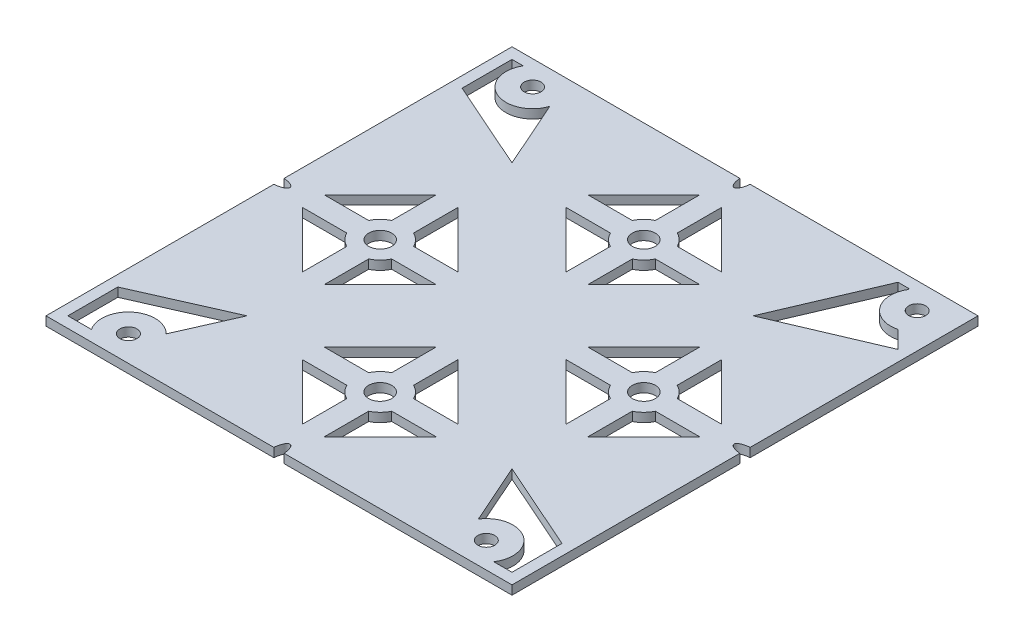
from build123d import *

# Parameters (mm, degrees)
SKETCH1_W           = 97.6
SKETCH1_H           = 97.6
BOSS_EXTRUDE1_DEPTH = 1.85
SKETCH3_R           = 1.25
CUT_EXTRUDE1_DEPTH  = 10
FILLET1_R           = 0.2
SKETCH5_R           = 2.375
CUT_EXTRUDE2_DEPTH  = 10
SKETCH6_R           = 1.75
CUT_EXTRUDE3_DEPTH  = 139.039641188
SKETCH7_W           = 97.6
SKETCH7_H           = 1.85
CUT_EXTRUDE4_DEPTH  = 0.75
SKETCH8_W           = 96.85
SKETCH8_H           = 1.85
CUT_EXTRUDE5_DEPTH  = 0.75
SKETCH9_W           = 96.85
SKETCH9_H           = 1.85
CUT_EXTRUDE6_DEPTH  = 0.75
SKETCH12_W          = 96.1
SKETCH12_H          = 1.85
CUT_EXTRUDE7_DEPTH  = 0.75


with BuildPart() as part:
    # Sketch1 → Boss-Extrude1 (new body)
    with BuildSketch(Plane(origin=(0, 0, 0), x_dir=(1, 0, 0), z_dir=(0, 1, 0))):
        with Locations((48.8, 48.8)):
            Rectangle(SKETCH1_W, SKETCH1_H)
    extrude(amount=BOSS_EXTRUDE1_DEPTH)

    # Sketch3 → Cut-Extrude1 (cut)
    with BuildSketch(Plane.XZ):
        with BuildLine():
            Line((3, -84.3), (3, -94.6))
            Line((3, -94.6), (5.316079849, -94.6))
            ThreePointArc((5.316079849, -94.6), (7.792729855, -86.784550719), (15.285000001, -90.113353923))
            Line((15.285000001, -90.113353923), (21.472818771, -76.127181229))
            Line((21.472818771, -76.127181229), (3, -84.3))
        make_face()
        with BuildLine():
            Line((3, -13.3), (21.472818771, -21.472818771))
            Line((21.472818771, -21.472818771), (16.360495139, -9.917560959))
            ThreePointArc((16.360495139, -9.917560959), (8.975209709, -10.313312378), (7.873156109, -3))
            Line((7.873156109, -3), (3, -3))
            Line((3, -3), (3, -13.3))
        make_face()
        with BuildLine():
            Line((94.6, -13.3), (94.6, -3))
            Line((94.6, -3), (90.826843891, -3))
            ThreePointArc((90.826843891, -3), (89.267333256, -10.648445392), (81.630186258, -9.034513526))
            Line((81.630186258, -9.034513526), (76.127181229, -21.472818771))
            Line((76.127181229, -21.472818771), (94.6, -13.3))
        make_face()
        with BuildLine():
            Line((91.027327292, -86.172672708), (94.6, -82.6))
            Line((94.6, -82.6), (73.674141566, -73.674141566))
            Line((73.674141566, -73.674141566), (82.6, -94.6))
            Line((82.6, -94.6), (85.116873323, -94.6))
            ThreePointArc((85.116873323, -94.6), (85.157069093, -88.341897208), (91.027327292, -86.172672708))
        make_face()
        with Locations((89.66, -91.5)):
            Circle(SKETCH3_R)
        with Locations((10.05, -91.8)):
            Circle(SKETCH3_R)
        with Locations((12.45, -6.05)):
            Circle(SKETCH3_R)
        with Locations((86.25, -6.05)):
            Circle(SKETCH3_R)
    extrude(amount=-CUT_EXTRUDE1_DEPTH, mode=Mode.SUBTRACT)

    # Fillet1
    fillet1_edges = [part.edges().sort_by_distance(p)[0] for p in [
        (85.116873323, 0.925, -94.6),
    ]]
    fillet(fillet1_edges, radius=FILLET1_R)

    # Sketch5 → Cut-Extrude2 (cut)
    with BuildSketch(Plane.XZ):
        with BuildLine():
            Line((51.05, -80.617052601), (51.05, -89.767052601))
            Line((51.05, -89.767052601), (62.582493929, -78.234558673))
            Line((62.582493929, -78.234558673), (53.432493929, -78.234558673))
            ThreePointArc((53.432493929, -78.234558673), (52.441599923, -79.626158596), (51.05, -80.617052601))
        make_face()
        with BuildLine():
            Line((46.55, -89.767052601), (46.55, -80.617052601))
            ThreePointArc((46.55, -80.617052601), (45.158400077, -79.626158596), (44.167506071, -78.234558673))
            Line((44.167506071, -78.234558673), (35.017506071, -78.234558673))
            Line((35.017506071, -78.234558673), (46.55, -89.767052601))
        make_face()
        with BuildLine():
            Line((35.017506071, -73.734558673), (44.167506071, -73.734558673))
            ThreePointArc((44.167506071, -73.734558673), (45.158400077, -72.34295875), (46.55, -71.352064744))
            Line((46.55, -71.352064744), (46.55, -62.202064744))
            Line((46.55, -62.202064744), (35.017506071, -73.734558673))
        make_face()
        with BuildLine():
            ThreePointArc((51.05, -71.352064744), (52.441599923, -72.34295875), (53.432493929, -73.734558673))
            Line((53.432493929, -73.734558673), (62.582493929, -73.734558673))
            Line((62.582493929, -73.734558673), (51.05, -62.202064744))
            Line((51.05, -62.202064744), (51.05, -71.352064744))
        make_face()
        with BuildLine():
            Line((73.734558673, -35.017506071), (62.202064744, -46.55))
            Line((62.202064744, -46.55), (71.352064744, -46.55))
            ThreePointArc((71.352064744, -46.55), (72.34295875, -45.158400077), (73.734558673, -44.167506071))
            Line((73.734558673, -44.167506071), (73.734558673, -35.017506071))
        make_face()
        with BuildLine():
            ThreePointArc((73.734558673, -53.432493929), (72.34295875, -52.441599923), (71.352064744, -51.05))
            Line((71.352064744, -51.05), (62.202064744, -51.05))
            Line((62.202064744, -51.05), (73.734558673, -62.582493929))
            Line((73.734558673, -62.582493929), (73.734558673, -53.432493929))
        make_face()
        with BuildLine():
            Line((78.234558673, -35.017506071), (78.234558673, -44.167506071))
            ThreePointArc((78.234558673, -44.167506071), (79.626158596, -45.158400077), (80.617052601, -46.55))
            Line((80.617052601, -46.55), (89.767052601, -46.55))
            Line((89.767052601, -46.55), (78.234558673, -35.017506071))
        make_face()
        with BuildLine():
            ThreePointArc((80.617052601, -51.05), (79.626158596, -52.441599923), (78.234558673, -53.432493929))
            Line((78.234558673, -53.432493929), (78.234558673, -62.582493929))
            Line((78.234558673, -62.582493929), (89.767052601, -51.05))
            Line((89.767052601, -51.05), (80.617052601, -51.05))
        make_face()
        with BuildLine():
            Line((46.55, -16.982947399), (46.55, -7.832947399))
            Line((46.55, -7.832947399), (35.017506071, -19.365441327))
            Line((35.017506071, -19.365441327), (44.167506071, -19.365441327))
            ThreePointArc((44.167506071, -19.365441327), (45.158400077, -17.973841404), (46.55, -16.982947399))
        make_face()
        with BuildLine():
            Line((51.05, -7.832947399), (51.05, -16.982947399))
            ThreePointArc((51.05, -16.982947399), (52.441599923, -17.973841404), (53.432493929, -19.365441327))
            Line((53.432493929, -19.365441327), (62.582493929, -19.365441327))
            Line((62.582493929, -19.365441327), (51.05, -7.832947399))
        make_face()
        with BuildLine():
            ThreePointArc((46.55, -26.247935256), (45.158400077, -25.25704125), (44.167506071, -23.865441327))
            Line((44.167506071, -23.865441327), (35.017506071, -23.865441327))
            Line((35.017506071, -23.865441327), (46.55, -35.397935256))
            Line((46.55, -35.397935256), (46.55, -26.247935256))
        make_face()
        with BuildLine():
            Line((62.582493929, -23.865441327), (53.432493929, -23.865441327))
            ThreePointArc((53.432493929, -23.865441327), (52.441599923, -25.25704125), (51.05, -26.247935256))
            Line((51.05, -26.247935256), (51.05, -35.397935256))
            Line((51.05, -35.397935256), (62.582493929, -23.865441327))
        make_face()
        with BuildLine():
            Line((23.865441327, -62.582493929), (35.397935256, -51.05))
            Line((35.397935256, -51.05), (26.247935256, -51.05))
            ThreePointArc((26.247935256, -51.05), (25.25704125, -52.441599923), (23.865441327, -53.432493929))
            Line((23.865441327, -53.432493929), (23.865441327, -62.582493929))
        make_face()
        with BuildLine():
            Line((19.365441327, -62.582493929), (19.365441327, -53.432493929))
            ThreePointArc((19.365441327, -53.432493929), (17.973841404, -52.441599923), (16.982947399, -51.05))
            Line((16.982947399, -51.05), (7.832947399, -51.05))
            Line((7.832947399, -51.05), (19.365441327, -62.582493929))
        make_face()
        with BuildLine():
            ThreePointArc((23.865441327, -44.167506071), (25.25704125, -45.158400077), (26.247935256, -46.55))
            Line((26.247935256, -46.55), (35.397935256, -46.55))
            Line((35.397935256, -46.55), (23.865441327, -35.017506071))
            Line((23.865441327, -35.017506071), (23.865441327, -44.167506071))
        make_face()
        with BuildLine():
            Line((7.832947399, -46.55), (16.982947399, -46.55))
            ThreePointArc((16.982947399, -46.55), (17.973841404, -45.158400077), (19.365441327, -44.167506071))
            Line((19.365441327, -44.167506071), (19.365441327, -35.017506071))
            Line((19.365441327, -35.017506071), (7.832947399, -46.55))
        make_face()
        with BuildLine():
            Line((47.7, -97.6), (49.9, -97.6))
            add(Edge.make_bspline(
                [(49.9, -97.6), (49.9, -94.604595373), (48.8, -94.604595373)],
                knots=[4.71238898, 4.71238898, 4.71238898, 6.283185307, 6.283185307, 6.283185307], degree=2, weights=[1, 0.707106781, 1]))
            add(Edge.make_bspline(
                [(48.8, -94.604595373), (47.7, -94.604595373), (47.7, -97.6)],
                knots=[0, 0, 0, 1.570796327, 1.570796327, 1.570796327], degree=2, weights=[1, 0.707106781, 1]))
        make_face()
        with BuildLine():
            add(Edge.make_bspline(
                [(94.596161078, -48.8), (94.596161078, -49.9), (97.6, -49.9)],
                knots=[0, 0, 0, 1.570796327, 1.570796327, 1.570796327], degree=2, weights=[1, 0.707106781, 1]))
            Line((97.6, -49.9), (97.6, -47.7))
            add(Edge.make_bspline(
                [(97.6, -47.7), (94.596161078, -47.7), (94.596161078, -48.8)],
                knots=[4.71238898, 4.71238898, 4.71238898, 6.283185307, 6.283185307, 6.283185307], degree=2, weights=[1, 0.707106781, 1]))
        make_face()
        with BuildLine():
            Line((0, -47.7), (0, -49.9))
            add(Edge.make_bspline(
                [(0, -49.9), (3, -49.9), (3, -48.8)],
                knots=[4.71238898, 4.71238898, 4.71238898, 6.283185307, 6.283185307, 6.283185307], degree=2, weights=[1, 0.707106781, 1]))
            add(Edge.make_bspline(
                [(3, -48.8), (3, -47.7), (0, -47.7)],
                knots=[0, 0, 0, 1.570796327, 1.570796327, 1.570796327], degree=2, weights=[1, 0.707106781, 1]))
        make_face()
        with BuildLine():
            add(Edge.make_bspline(
                [(48.8, -3), (49.9, -3), (49.9, 0)],
                knots=[0, 0, 0, 1.570796327, 1.570796327, 1.570796327], degree=2, weights=[1, 0.707106781, 1]))
            Line((49.9, 0), (47.7, 0))
            add(Edge.make_bspline(
                [(47.7, 0), (47.7, -3), (48.8, -3)],
                knots=[4.71238898, 4.71238898, 4.71238898, 6.283185307, 6.283185307, 6.283185307], degree=2, weights=[1, 0.707106781, 1]))
        make_face()
        with Locations((48.8, -75.984558673)):
            Circle(SKETCH5_R)
        with Locations((75.984558673, -48.8)):
            Circle(SKETCH5_R)
        with Locations((48.8, -21.615441327)):
            Circle(SKETCH5_R)
        with Locations((21.615441327, -48.8)):
            Circle(SKETCH5_R)
    extrude(amount=-CUT_EXTRUDE2_DEPTH, mode=Mode.SUBTRACT)

    # Sketch6 → Cut-Extrude3 (cut, through all)
    with BuildSketch(Plane.XZ):
        with Locations((12.45, -6.05)):
            Circle(SKETCH6_R)
        with Locations((86.25, -6.05)):
            Circle(SKETCH6_R)
        with Locations((10.05, -91.8)):
            Circle(SKETCH6_R)
        with Locations((89.66, -91.5)):
            Circle(SKETCH6_R)
    extrude(amount=-CUT_EXTRUDE3_DEPTH, mode=Mode.SUBTRACT)

    # Sketch7 → Cut-Extrude4 (cut)
    with BuildSketch(Plane(origin=(0, 0, -97.6), x_dir=(-1, 0, 0), z_dir=(0, 0, -1))):
        with Locations((-48.8, 0.925)):
            Rectangle(SKETCH7_W, SKETCH7_H)
    extrude(amount=-CUT_EXTRUDE4_DEPTH, mode=Mode.SUBTRACT)

    # Sketch8 → Cut-Extrude5 (cut)
    with BuildSketch(Plane(origin=(97.6, 0, 0), x_dir=(0, 0, -1), z_dir=(1, 0, 0))):
        with Locations((48.425, 0.925)):
            Rectangle(SKETCH8_W, SKETCH8_H)
    extrude(amount=-CUT_EXTRUDE5_DEPTH, mode=Mode.SUBTRACT)

    # Sketch9 → Cut-Extrude6 (cut)
    with BuildSketch(Plane.XY):
        with Locations((48.425, 0.925)):
            Rectangle(SKETCH9_W, SKETCH9_H)
    extrude(amount=-CUT_EXTRUDE6_DEPTH, mode=Mode.SUBTRACT)

    # Sketch12 → Cut-Extrude7 (cut)
    with BuildSketch(Plane.ZY):
        with Locations((-48.8, 0.925)):
            Rectangle(SKETCH12_W, SKETCH12_H)
    extrude(amount=-CUT_EXTRUDE7_DEPTH, mode=Mode.SUBTRACT)


solid = part.part
